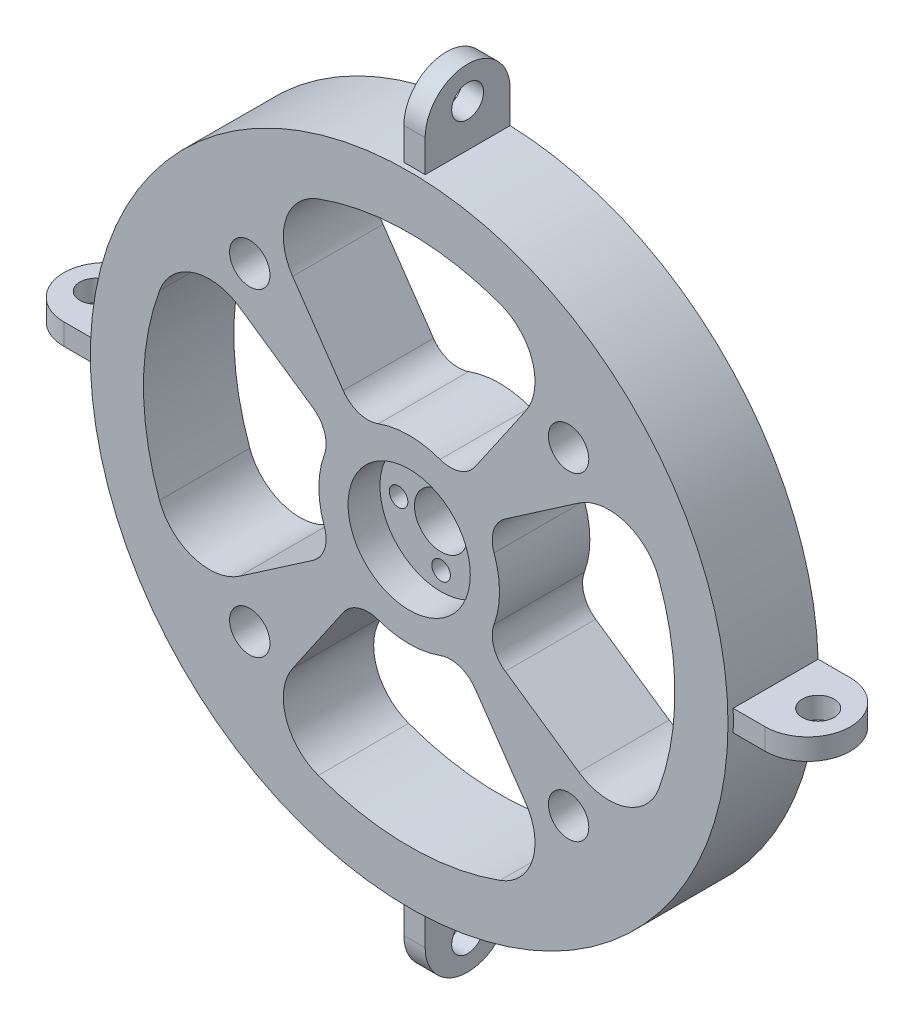
from build123d import *

# Parameters (mm, degrees)
SKETCH_1_R               = 60
EXTRUDE_1_DEPTH          = 17
SKETCH_2_R               = 3.8
CUT_EXTRUDE_1_DEPTH      = 87.539008545
EXTRUDE_2_DEPTH          = 2
SKETCH_4_R               = 3
CUT_EXTRUDE_7_DEPTH      = 99.025506885
CUT_EXTRUDE_3_REACH      = 98.773
SKETCH_5_R               = 5
SKETCH_6_R               = 11.5
CUT_EXTRUDE_4_DEPTH      = 6
CUT_EXTRUDE_5_REACH      = 97.901
SKETCH_7_R               = 1.75
CUT_EXTRUDE_6_REACH      = 98.773
PATTERN_CIRCULAR_3_COUNT = 4
PATTERN_CIRCULAR_4_COUNT = 4


with BuildPart() as part:
    # 草图1 → 凸台-拉伸1 (new body)
    with BuildSketch(Plane.XY):
        Circle(SKETCH_1_R)
    extrude(amount=EXTRUDE_1_DEPTH)

    # 草图2 → 切除-拉伸1 (cut, through all)
    with BuildSketch(Plane.XY.offset(17)):
        with Locations((-30, 30)):
            Circle(SKETCH_2_R)
        with Locations((30, 30)):
            Circle(SKETCH_2_R)
        with Locations((30, -30)):
            Circle(SKETCH_2_R)
        with Locations((-30, -30)):
            Circle(SKETCH_2_R)
    extrude(amount=-CUT_EXTRUDE_1_DEPTH, mode=Mode.SUBTRACT)

    # 草图3 → 凸台-拉伸2 (add, symmetric)
    with BuildSketch(Plane(origin=(0, 0, 0), x_dir=(0, 0, -1), z_dir=(1, 0, 0))):
        with BuildLine():
            Line((0, 58), (-16, 58))
            Line((-16, 58), (-16, 66))
            ThreePointArc((-16, 66), (-8, 74), (0, 66))
            Line((0, 66), (0, 58))
        make_face()
    extrude_2 = extrude(amount=EXTRUDE_2_DEPTH, both=True)

    # 草图4 → 切除-拉伸7 (cut, through all)
    with BuildSketch(Plane(origin=(2, 0, 0), x_dir=(0, 0, -1), z_dir=(1, 0, 0))):
        with Locations((-8, 67.966657402)):
            Circle(SKETCH_4_R)
    cut_extrude_7 = extrude(amount=-CUT_EXTRUDE_7_DEPTH, mode=Mode.SUBTRACT)

    # 草图5 → 切除-拉伸3 (cut, up to next)
    with BuildSketch(Plane(origin=(0, 0, 0), x_dir=(-1, 0, 0), z_dir=(0, 0, -1)), mode=Mode.PRIVATE) as cut_extrude_3_sk1:
        Circle(SKETCH_5_R)
    cut_extrude_3_tool1 = extrude(cut_extrude_3_sk1.sketch, amount=-CUT_EXTRUDE_3_REACH, mode=Mode.PRIVATE) & part.part
    add(cut_extrude_3_tool1.solids().sort_by_distance((0, 0, 0))[0], mode=Mode.SUBTRACT)

    # 草图6 → 切除-拉伸4 (cut)
    with BuildSketch(Plane.XY.offset(17)):
        Circle(SKETCH_6_R)
    extrude(amount=-CUT_EXTRUDE_4_DEPTH, mode=Mode.SUBTRACT)

    # 草图7 → 切除-拉伸5 (cut, up to next)
    with BuildSketch(Plane.XY.offset(11), mode=Mode.PRIVATE) as cut_extrude_5_sk1:
        with Locations((-8, 0)):
            Circle(SKETCH_7_R)
    cut_extrude_5_tool1 = extrude(cut_extrude_5_sk1.sketch, amount=-CUT_EXTRUDE_5_REACH, mode=Mode.PRIVATE) & part.part
    # 草图7 → 切除-拉伸5 (cut, up to next)
    with BuildSketch(Plane.XY.offset(11), mode=Mode.PRIVATE) as cut_extrude_5_sk2:
        with Locations((0, 8)):
            Circle(SKETCH_7_R)
    cut_extrude_5_tool2 = extrude(cut_extrude_5_sk2.sketch, amount=-CUT_EXTRUDE_5_REACH, mode=Mode.PRIVATE) & part.part
    # 草图7 → 切除-拉伸5 (cut, up to next)
    with BuildSketch(Plane.XY.offset(11), mode=Mode.PRIVATE) as cut_extrude_5_sk3:
        with Locations((8, 0)):
            Circle(SKETCH_7_R)
    cut_extrude_5_tool3 = extrude(cut_extrude_5_sk3.sketch, amount=-CUT_EXTRUDE_5_REACH, mode=Mode.PRIVATE) & part.part
    # 草图7 → 切除-拉伸5 (cut, up to next)
    with BuildSketch(Plane.XY.offset(11), mode=Mode.PRIVATE) as cut_extrude_5_sk4:
        with Locations((0, -8)):
            Circle(SKETCH_7_R)
    cut_extrude_5_tool4 = extrude(cut_extrude_5_sk4.sketch, amount=-CUT_EXTRUDE_5_REACH, mode=Mode.PRIVATE) & part.part
    add(cut_extrude_5_tool1.solids().sort_by_distance((-8, 0, 11))[0], mode=Mode.SUBTRACT)
    add(cut_extrude_5_tool2.solids().sort_by_distance((0, 8, 11))[0], mode=Mode.SUBTRACT)
    add(cut_extrude_5_tool3.solids().sort_by_distance((8, 0, 11))[0], mode=Mode.SUBTRACT)
    add(cut_extrude_5_tool4.solids().sort_by_distance((0, -8, 11))[0], mode=Mode.SUBTRACT)

    # 草图8 → 切除-拉伸6 (cut, up to next)
    with BuildSketch(Plane.XY.offset(17), mode=Mode.PRIVATE) as cut_extrude_6_sk1:
        with BuildLine():
            Line((-18.09189724, 12.423764363), (-31.926877482, 21.924290052))
            ThreePointArc((-31.926877482, 21.924290052), (-40.638216775, 23.204165271), (-46.984631039, 17.101007166))
            ThreePointArc((-46.984631039, 17.101007166), (-50, 0), (-46.984631039, -17.101007166))
            ThreePointArc((-46.984631039, -17.101007166), (-40.638216775, -23.204165271), (-31.926877482, -21.924290052))
            Line((-31.926877482, -21.924290052), (-18.09189724, -12.423764363))
            ThreePointArc((-18.09189724, -12.423764363), (-15.903129, -9.481080017), (-15.974774553, -5.814342437))
            ThreePointArc((-15.974774553, -5.814342437), (-17, 0), (-15.974774553, 5.814342437))
            ThreePointArc((-15.974774553, 5.814342437), (-15.903129, 9.481080017), (-18.09189724, 12.423764363))
        make_face()
    cut_extrude_6_tool1 = extrude(cut_extrude_6_sk1.sketch, amount=-CUT_EXTRUDE_6_REACH, mode=Mode.PRIVATE) & part.part
    cut_extrude_6 = cut_extrude_6_tool1.solids().sort_by_distance((-33.87223, 0, 17))[0]
    add(cut_extrude_6, mode=Mode.SUBTRACT)

    # 阵列(圆周)3: 切除-拉伸6 ×4 about axis
    pattern_circular_3_axis = Axis((0, 0, 17), (0, 0, 1))
    for i in range(1, PATTERN_CIRCULAR_3_COUNT):
        add(cut_extrude_6.rotate(pattern_circular_3_axis, i * 360 / PATTERN_CIRCULAR_3_COUNT), mode=Mode.SUBTRACT)

    # 阵列(圆周)4: 凸台-拉伸2, 切除-拉伸7 ×4 about axis
    pattern_circular_4_axis = Axis((0, 0, 17), (0, 0, 1))
    add([extrude_2.rotate(pattern_circular_4_axis, i * 360 / PATTERN_CIRCULAR_4_COUNT) for i in range(1, PATTERN_CIRCULAR_4_COUNT)])
    add([cut_extrude_7.rotate(pattern_circular_4_axis, i * 360 / PATTERN_CIRCULAR_4_COUNT) for i in range(1, PATTERN_CIRCULAR_4_COUNT)], mode=Mode.SUBTRACT)


solid = part.part
